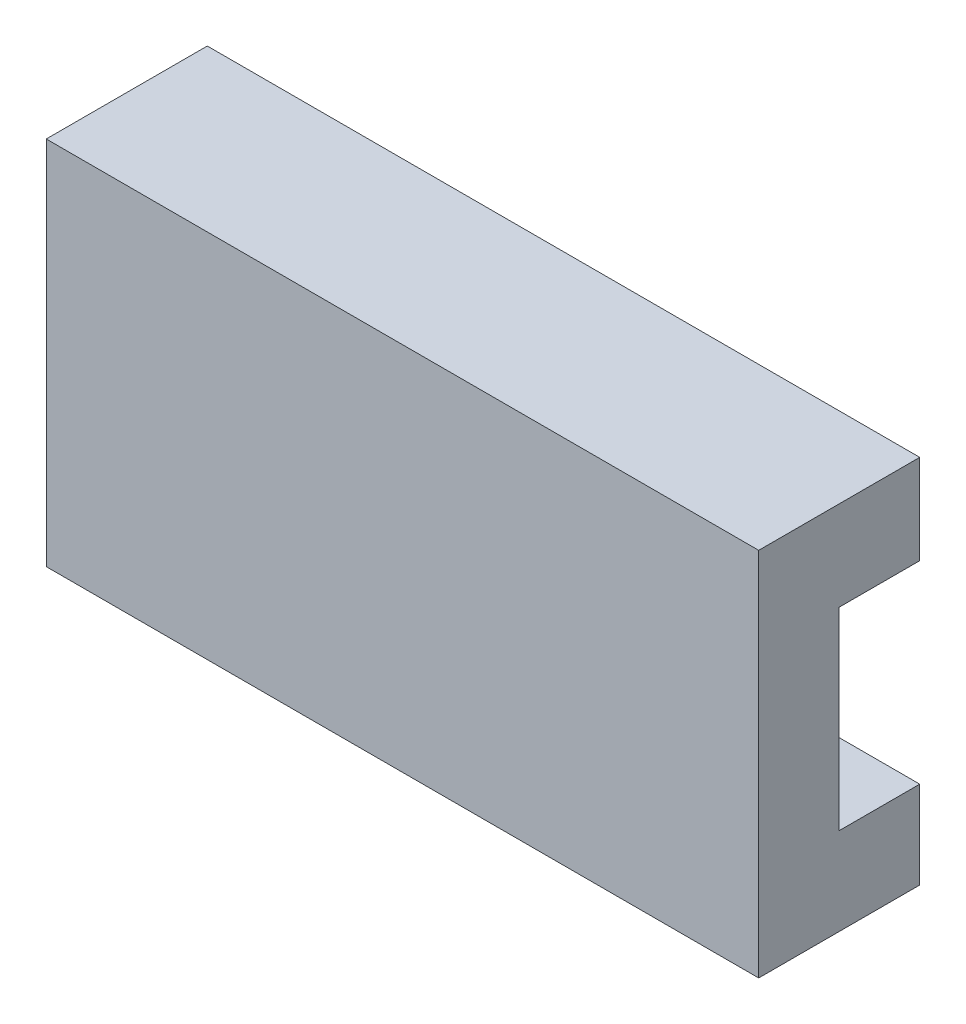
from build123d import *

# Parameters (mm, degrees)
SKETCH1_W           = 44.241636344
SKETCH1_H           = 23
BOSS_EXTRUDE1_DEPTH = 10
SKETCH2_W           = 44.241636344
SKETCH2_H           = 12.016013524
CUT_EXTRUDE1_DEPTH  = 5


with BuildPart() as part:
    # Sketch1 → Boss-Extrude1 (new body)
    with BuildSketch(Plane.XY):
        with Locations((0, 2)):
            Rectangle(SKETCH1_W, SKETCH1_H)
    extrude(amount=BOSS_EXTRUDE1_DEPTH)

    # Sketch2 → Cut-Extrude1 (cut)
    with BuildSketch(Plane.XY):
        with Locations((0, 1.933466246)):
            Rectangle(SKETCH2_W, SKETCH2_H)
    extrude(amount=CUT_EXTRUDE1_DEPTH, mode=Mode.SUBTRACT)


solid = part.part
